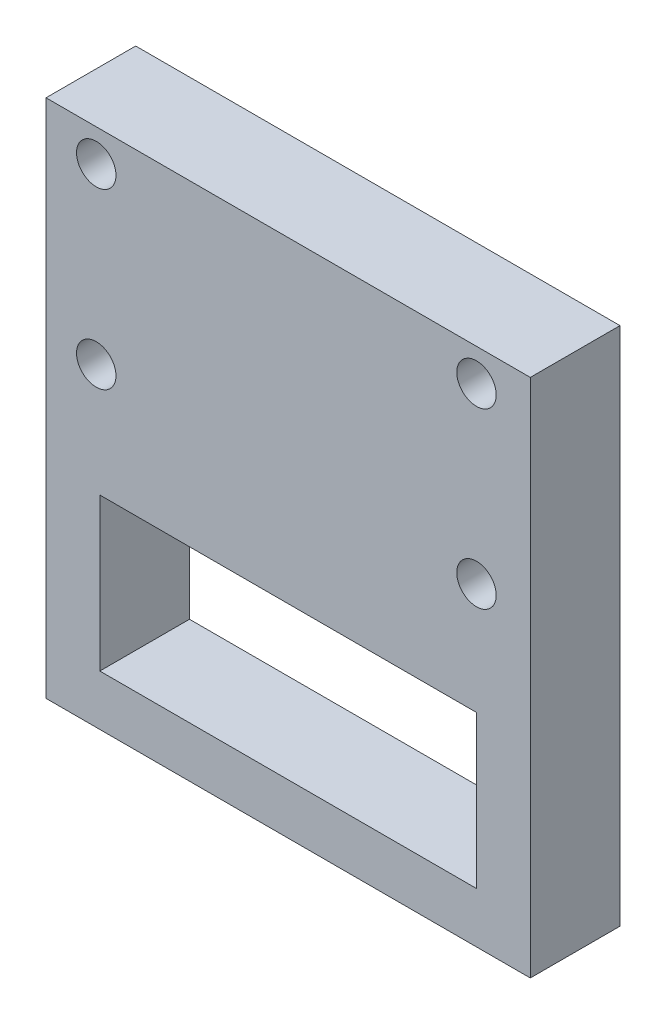
from build123d import *

# Parameters (mm, degrees)
SKETCH1_W           = 27
SKETCH1_H           = 29
BOSS_EXTRUDE1_DEPTH = 5
SKETCH2_R           = 1.25
CUT_EXTRUDE1_DEPTH  = 2.18
SKETCH3_R           = 1.1
CUT_EXTRUDE2_DEPTH  = 10
SKETCH4_W           = 21
SKETCH4_H           = 8.5
CUT_EXTRUDE3_DEPTH  = 10


with BuildPart() as part:
    # Sketch1 → Boss-Extrude1 (new body)
    with BuildSketch(Plane.XY):
        Rectangle(SKETCH1_W, SKETCH1_H)
    extrude(amount=BOSS_EXTRUDE1_DEPTH)

    # Sketch2 → Cut-Extrude1 (cut)
    with BuildSketch(Plane.XZ.offset(14.5)):
        with Locations((-7, 2.5)):
            Circle(SKETCH2_R)
        with Locations((0, 2.5)):
            Circle(SKETCH2_R)
        with Locations((7, 2.5)):
            Circle(SKETCH2_R)
    extrude(amount=-CUT_EXTRUDE1_DEPTH, mode=Mode.SUBTRACT)

    # Sketch3 → Cut-Extrude2 (cut)
    with BuildSketch(Plane.XY.offset(5)):
        with Locations((-10.7, 12.7)):
            Circle(SKETCH3_R)
        with Locations((10.5, 12.7)):
            Circle(SKETCH3_R)
        with Locations((-10.7, 3.025)):
            Circle(SKETCH3_R)
        with Locations((10.5, 3.025)):
            Circle(SKETCH3_R)
    extrude(amount=-CUT_EXTRUDE2_DEPTH, mode=Mode.SUBTRACT)

    # Sketch4 → Cut-Extrude3 (cut)
    with BuildSketch(Plane.XY.offset(5)):
        with Locations((0, -7.429078055)):
            Rectangle(SKETCH4_W, SKETCH4_H)
    extrude(amount=-CUT_EXTRUDE3_DEPTH, mode=Mode.SUBTRACT)


solid = part.part
